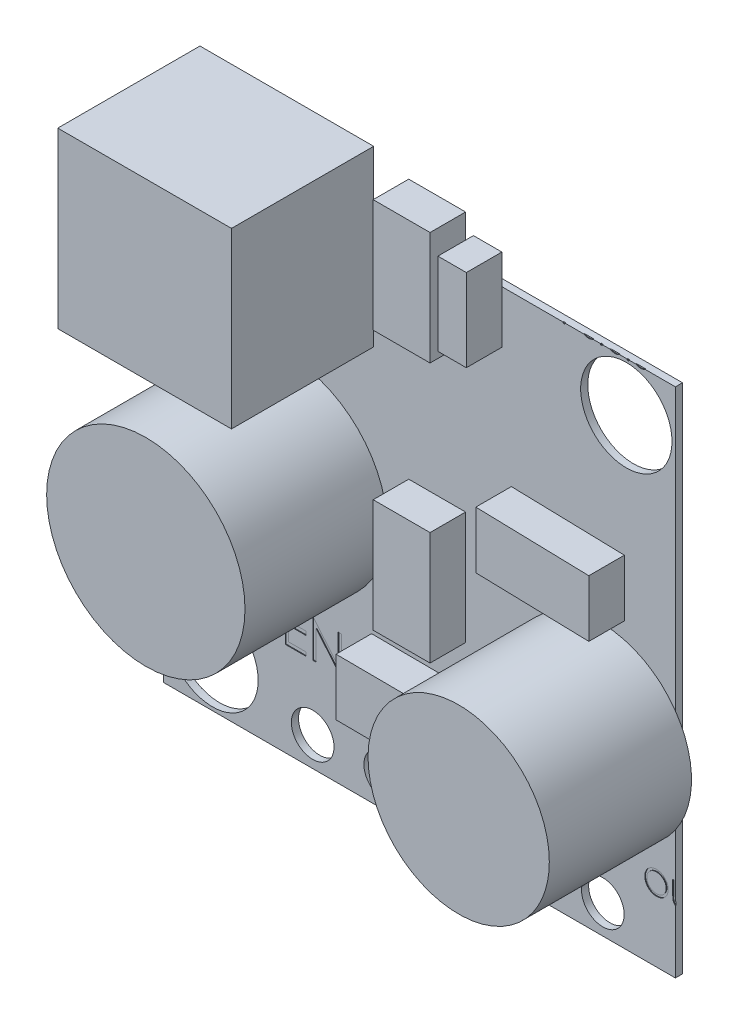
from build123d import *

# Parameters (mm, degrees)
SKETCH1_W           = 18.291840078
SKETCH1_H           = 18.291840078
SKETCH1_R           = 1.63195
SKETCH1_R_2         = 0.762
BOSS_EXTRUDE2_DEPTH = 0.254
SKETCH2_R           = 3.5433
SKETCH2_R_2         = 3.2385
SKETCH2_W           = 6.206288666
SKETCH2_H           = 6.206288667
BOSS_EXTRUDE3_DEPTH = 5.08
SKETCH3_W           = 2.032
SKETCH3_H           = 4.0386
SKETCH3_W_2         = 1.016
SKETCH3_H_2         = 2.9464
BOSS_EXTRUDE4_DEPTH = 1.27
SKETCH4_W           = 0.071233974
SKETCH4_H           = 0.814102564
SKETCH4_W_2         = 0.071233975
SKETCH4_H_2         = 0.79375
CUT_EXTRUDE1_DEPTH  = 0.0254


with BuildPart() as part:
    # Sketch1 → Boss-Extrude2 (new body)
    with BuildSketch(Plane.XY):
        with Locations((8.062281232, 8.564786777)):
            Rectangle(SKETCH1_W, SKETCH1_H)
        with Locations((0.668961193, 1.171466738)):
            Circle(SKETCH1_R, mode=Mode.SUBTRACT)
        with Locations((15.455601271, 15.958106816)):
            Circle(SKETCH1_R, mode=Mode.SUBTRACT)
        with Locations((4.250361193, 0.465539417)):
            Circle(SKETCH1_R_2, mode=Mode.SUBTRACT)
        with Locations((6.841929209, 0.465539417)):
            Circle(SKETCH1_R_2, mode=Mode.SUBTRACT)
        with Locations((9.433497224, 0.465539417)):
            Circle(SKETCH1_R_2, mode=Mode.SUBTRACT)
        with Locations((12.02506524, 0.465539417)):
            Circle(SKETCH1_R_2, mode=Mode.SUBTRACT)
        with Locations((14.616633255, 0.465539417)):
            Circle(SKETCH1_R_2, mode=Mode.SUBTRACT)
    extrude(amount=BOSS_EXTRUDE2_DEPTH)

    # Sketch2 → Boss-Extrude3 (add)
    with BuildSketch(Plane.XY.offset(0.254)):
        with Locations((3.367424674, 8.222212501)):
            Circle(SKETCH2_R)
        with Locations((14.545239743, 5.842060174)):
            Circle(SKETCH2_R_2)
        with Locations((3.324815917, 16.660413121)):
            Rectangle(SKETCH2_W, SKETCH2_H)
    extrude(amount=BOSS_EXTRUDE3_DEPTH)

    # Sketch3 → Boss-Extrude4 (add)
    with BuildSketch(Plane.XY.offset(0.254)):
        Polygon((6.3543759, 4.646336431), (10.392892165, 4.620330016), (10.393031369, 2.588330021), (6.354515103, 2.614336436), align=None)
        with Locations((8.696702908, 8.069982675)):
            Rectangle(SKETCH3_W, SKETCH3_H)
        with Locations((8.696702908, 17.354271733)):
            Rectangle(SKETCH3_W, SKETCH3_H)
        Polygon((11.34760699, 11.694074063), (15.38486701, 11.590047681), (15.387094643, 9.558048902), (11.349834623, 9.662075284), align=None)
        with Locations((10.50132769, 17.309698928)):
            Rectangle(SKETCH3_W_2, SKETCH3_H_2)
    extrude(amount=BOSS_EXTRUDE4_DEPTH)

    # Sketch4 → Cut-Extrude1 (cut)
    # profile 1 of 17: a face of its own
    with BuildSketch(Plane.XY.offset(0.254)):
        with BuildLine():
            Line((13.191799409, 18.469298806), (13.347464724, 18.469298806))
            add(Edge.make_bspline(
                [(13.347464724, 18.469298806), (13.358171483, 18.469287037), (13.378686109, 18.469264486), (13.40810363, 18.468580785), (13.434821194, 18.467667589), (13.458781192, 18.466401695), (13.480057342, 18.464905683), (13.498553373, 18.462807453), (13.514414665, 18.460616635), (13.523918449, 18.458389281), (13.528252735, 18.457373476)],
                knots=[0, 0, 0, 0, 1.415646017, 2.712440637, 3.8905458, 4.950247383, 5.884950622, 6.709939814, 7.411656543, 8, 8, 8, 8], degree=3))
            add(Edge.make_bspline(
                [(13.528252735, 18.457373476), (13.533739482, 18.455871712), (13.54458369, 18.452903572), (13.560209462, 18.446958674), (13.575076138, 18.439909683), (13.589234723, 18.43187604), (13.602511231, 18.422513063), (13.615103744, 18.412200297), (13.626901133, 18.400699637), (13.637837055, 18.388140077), (13.647880215, 18.374732458), (13.656527482, 18.36027663), (13.663768121, 18.345015924), (13.669978256, 18.328960954), (13.674447852, 18.311976898), (13.677814917, 18.294181769), (13.679952061, 18.275577473), (13.680156749, 18.262863896), (13.680260948, 18.256391905)],
                knots=[0, 0, 0, 0, 0.999701418, 1.975846123, 2.934577507, 3.890451536, 4.834027766, 5.787354733, 6.749476667, 7.726910423, 8.712836071, 9.690891519, 10.682875813, 11.679750201, 12.712814741, 13.765529915, 14.8625177, 16, 16, 16, 16], degree=3))
            add(Edge.make_bspline(
                [(13.680260948, 18.256391905), (13.680165375, 18.249865517), (13.679978379, 18.237096196), (13.677734043, 18.218415225), (13.674710946, 18.200563018), (13.670062508, 18.183579161), (13.663974292, 18.167564513), (13.656832345, 18.152274341), (13.648218223, 18.137968772), (13.638320199, 18.124595872), (13.627309391, 18.112143089), (13.615232385, 18.100700662), (13.602137938, 18.090335571), (13.588067666, 18.081024579), (13.572884396, 18.072983601), (13.556818408, 18.065781498), (13.539730055, 18.059732883), (13.527904878, 18.056551065), (13.521892558, 18.054933322)],
                knots=[0, 0, 0, 0, 1.121902311, 2.195077645, 3.232258892, 4.234102512, 5.217864754, 6.176164875, 7.132989551, 8.084763148, 9.034132444, 9.988522005, 10.94243251, 11.903244335, 12.886203696, 13.894208494, 14.929344452, 16, 16, 16, 16], degree=3))
            add(Edge.make_bspline(
                [(13.521892558, 18.054933322), (13.516919752, 18.053875824), (13.506021558, 18.051558257), (13.48807312, 18.048970982), (13.467175863, 18.046762633), (13.44335831, 18.045106839), (13.41664184, 18.043689345), (13.387012002, 18.042562652), (13.35441063, 18.041943561), (13.331670545, 18.041911631), (13.319797957, 18.04189496)],
                knots=[0, 0, 0, 0, 0.601384939, 1.31797006, 2.144135048, 3.087295005, 4.142315834, 5.309527816, 6.595305764, 8, 8, 8, 8], degree=3))
            Line((13.319797957, 18.04189496), (13.263033384, 18.04189496))
            Line((13.263033384, 18.04189496), (13.263033384, 17.675548806))
            Line((13.263033384, 17.675548806), (13.191799409, 17.675548806))
            Line((13.191799409, 17.675548806), (13.191799409, 18.469298806))
        make_face()
        with BuildLine():
            Line((13.263033384, 18.38788855), (13.263033384, 18.123305217))
            Line((13.263033384, 18.123305217), (13.402003235, 18.121556168))
            add(Edge.make_bspline(
                [(13.402003235, 18.121556168), (13.408788647, 18.121552661), (13.421887745, 18.121545891), (13.440809888, 18.122449683), (13.458365209, 18.123493018), (13.474499782, 18.125020629), (13.489220881, 18.127179914), (13.502553053, 18.129359719), (13.514392919, 18.132513257), (13.528249345, 18.136759381), (13.543689676, 18.144001242), (13.560487138, 18.154512735), (13.57472261, 18.167911396), (13.587041224, 18.182976279), (13.596817021, 18.199735546), (13.603973469, 18.217667251), (13.608178339, 18.236587496), (13.608742172, 18.24953427), (13.609026973, 18.256073896)],
                knots=[0, 0, 0, 0, 1.160613943, 2.240541288, 3.23993089, 4.169200891, 5.011653406, 5.7853311, 6.478053781, 7.106038997, 8.262395093, 9.384106736, 10.481365981, 11.59014053, 12.70357646, 13.786202915, 14.881775077, 16, 16, 16, 16], degree=3))
            add(Edge.make_bspline(
                [(13.609026973, 18.256073896), (13.608740623, 18.262455309), (13.608171394, 18.275140768), (13.603940511, 18.29373238), (13.596830935, 18.31147512), (13.5869756, 18.328024374), (13.575014665, 18.343035049), (13.56111285, 18.356074576), (13.545302878, 18.366556998), (13.530596226, 18.37332276), (13.517533099, 18.377453724), (13.506186566, 18.380344072), (13.493375288, 18.382651754), (13.479095095, 18.384520355), (13.46345667, 18.38611998), (13.446325659, 18.387205371), (13.427766958, 18.387840701), (13.414883132, 18.387872214), (13.408204407, 18.38788855)],
                knots=[0, 0, 0, 0, 1.120700087, 2.227813068, 3.331159281, 4.466773991, 5.599788987, 6.693661531, 7.80175334, 8.91857717, 9.525282508, 10.207424825, 10.974604443, 11.810962634, 12.737642355, 13.736264703, 14.826523623, 16, 16, 16, 16], degree=3))
            Line((13.408204407, 18.38788855), (13.263033384, 18.38788855))
        make_face(mode=Mode.SUBTRACT)
    # profile 2 of 17: a face of its own
    with BuildSketch(Plane.XY.offset(0.254)):
        with BuildLine():
            add(Edge.make_bspline(
                [(14.102894662, 18.265773165), (14.113778397, 18.265541415), (14.135118741, 18.265087009), (14.166371601, 18.260230401), (14.196204159, 18.252803767), (14.22473067, 18.242536823), (14.251585794, 18.228775024), (14.277160702, 18.212353631), (14.301385273, 18.192899364), (14.315904782, 18.177850302), (14.32327477, 18.170211517)],
                knots=[0, 0, 0, 0, 1.054011418, 2.066658804, 3.057071809, 4.030435133, 4.997543892, 5.974964718, 6.972108034, 8, 8, 8, 8], degree=3))
            add(Edge.make_bspline(
                [(14.32327477, 18.170211517), (14.329620677, 18.162905845), (14.342189681, 18.148435886), (14.358306371, 18.124973631), (14.372190546, 18.100675787), (14.383317325, 18.075219697), (14.392090536, 18.048827584), (14.398319363, 18.021408735), (14.402024347, 17.993023703), (14.402523948, 17.973746046), (14.402776973, 17.963982801)],
                knots=[0, 0, 0, 0, 1.025258237, 2.030674902, 3.01204498, 3.988269485, 4.97094183, 5.956517959, 6.965070386, 8, 8, 8, 8], degree=3))
            add(Edge.make_bspline(
                [(14.402776973, 17.963982801), (14.40255442, 17.954162966), (14.402114644, 17.934758515), (14.397954574, 17.906179123), (14.391484132, 17.878467083), (14.382224054, 17.851738415), (14.370349983, 17.825911417), (14.355860488, 17.801098894), (14.338653889, 17.777251892), (14.319149411, 17.754572904), (14.297593003, 17.733670923), (14.274207734, 17.715453619), (14.249453158, 17.699845881), (14.223000112, 17.687273694), (14.195090164, 17.677360958), (14.165663115, 17.670398633), (14.134764679, 17.666189108), (14.113667434, 17.665648548), (14.102894662, 17.665372524)],
                knots=[0, 0, 0, 0, 0.998656419, 1.973391657, 2.932242238, 3.890759089, 4.846373663, 5.82037756, 6.809684879, 7.83454468, 8.860553229, 9.859544525, 10.845671541, 11.83227036, 12.833544569, 13.85385346, 14.904124723, 16, 16, 16, 16], degree=3))
            add(Edge.make_bspline(
                [(14.102894662, 17.665372524), (14.092069109, 17.665649474), (14.070866718, 17.666191894), (14.039859218, 17.670382278), (14.01037943, 17.677357749), (13.982432944, 17.68730627), (13.955866166, 17.699846283), (13.930968157, 17.715406434), (13.907563891, 17.733676326), (13.886002923, 17.75457144), (13.866499668, 17.77725227), (13.849292753, 17.801098796), (13.83480334, 17.825911442), (13.822929247, 17.851738408), (13.813669175, 17.878467085), (13.807198731, 17.906179123), (13.803038661, 17.934758515), (13.802598886, 17.954162966), (13.802376332, 17.963982801)],
                knots=[0, 0, 0, 0, 1.099876186, 2.154163076, 3.173186993, 4.173200201, 5.163417411, 6.152872554, 7.150605724, 8.17532212, 9.198891216, 10.186952605, 11.159729845, 12.11414092, 13.071450619, 14.029093627, 15.002601286, 16, 16, 16, 16], degree=3))
            add(Edge.make_bspline(
                [(13.802376332, 17.963982801), (13.802631083, 17.973692982), (13.803135446, 17.992917471), (13.806836704, 18.021249144), (13.813041234, 18.048621587), (13.821824961, 18.074911829), (13.833054299, 18.100256366), (13.846743377, 18.124614247), (13.863024467, 18.147970409), (13.875543481, 18.162421666), (13.881878536, 18.169734503)],
                knots=[0, 0, 0, 0, 1.031353054, 2.041901799, 3.029428768, 4.008703097, 4.981709435, 5.96992636, 6.972712378, 8, 8, 8, 8], degree=3))
            add(Edge.make_bspline(
                [(13.881878536, 18.169734503), (13.889237413, 18.177439534), (13.903709939, 18.192592833), (13.928055097, 18.211990388), (13.953567088, 18.228753497), (13.980718991, 18.242241853), (14.009222068, 18.25286416), (14.039207503, 18.260249554), (14.070566415, 18.265069511), (14.092011186, 18.265536276), (14.102894662, 18.265773165)],
                knots=[0, 0, 0, 0, 1.027980169, 2.021703884, 2.998553061, 3.971491411, 4.943284454, 5.930300938, 6.949603206, 8, 8, 8, 8], degree=3))
        make_face()
        with BuildLine():
            add(Edge.make_bspline(
                [(14.102576653, 18.194539191), (14.094880087, 18.194320435), (14.079685642, 18.193888571), (14.057320129, 18.190603829), (14.035789059, 18.185399662), (14.015051581, 18.178005528), (13.99517763, 18.168458099), (13.976148176, 18.156731382), (13.957907248, 18.142980694), (13.940811673, 18.127227552), (13.925122113, 18.11001928), (13.911406571, 18.091684027), (13.899744092, 18.072519195), (13.890028556, 18.052504854), (13.882792461, 18.031438182), (13.877537151, 18.009557753), (13.874255507, 17.986818989), (13.873827703, 17.971361044), (13.873610307, 17.963505788)],
                knots=[0, 0, 0, 0, 1.021534396, 2.016698045, 2.994645724, 3.958388632, 4.93408049, 5.916473867, 6.921342795, 7.962252576, 8.998418191, 10.008913653, 10.997312074, 11.973003931, 12.956656626, 13.948281152, 14.957379055, 16, 16, 16, 16], degree=3))
            add(Edge.make_bspline(
                [(13.873610307, 17.963505788), (13.873974711, 17.953356667), (13.874697986, 17.933212561), (13.880579728, 17.903546467), (13.890419116, 17.875066297), (13.903705874, 17.847939009), (13.920353356, 17.822840118), (13.939967387, 17.800462835), (13.962337462, 17.78114391), (13.987196918, 17.765114504), (14.014037987, 17.752378273), (14.042444331, 17.743352434), (14.072071774, 17.737485104), (14.092319368, 17.73690193), (14.102576653, 17.736606499)],
                knots=[0, 0, 0, 0, 1.016792936, 2.018143844, 3.017858371, 4.030088057, 5.03801393, 6.028138512, 7.003788237, 7.991172063, 8.984598303, 9.972568034, 10.972917682, 12, 12, 12, 12], degree=3))
            add(Edge.make_bspline(
                [(14.102576653, 17.736606499), (14.112833347, 17.736903651), (14.133079777, 17.737490223), (14.162666055, 17.743322884), (14.190994759, 17.752417821), (14.217807949, 17.76510018), (14.242656089, 17.781204781), (14.265187051, 17.800353745), (14.284633611, 17.822899386), (14.301264624, 17.847972254), (14.314768975, 17.875024241), (14.324562308, 17.903551723), (14.330458189, 17.933211222), (14.331179556, 17.953356219), (14.331542999, 17.963505788)],
                knots=[0, 0, 0, 0, 1.02726834, 2.027799167, 3.010890988, 4.004497153, 4.992059811, 5.971914811, 6.958719428, 7.966827853, 8.981595046, 9.981490638, 10.983022906, 12, 12, 12, 12], degree=3))
            add(Edge.make_bspline(
                [(14.331542999, 17.963505788), (14.331325677, 17.971361091), (14.330898021, 17.986819128), (14.327615305, 18.009557221), (14.32236396, 18.031440136), (14.315113254, 18.052497644), (14.305439933, 18.072571016), (14.293552553, 18.091627757), (14.279893017, 18.110082795), (14.264014134, 18.127171925), (14.246936404, 18.142986835), (14.228688083, 18.156736714), (14.209686846, 18.168406562), (14.189870632, 18.178087191), (14.169130496, 18.185332392), (14.147629594, 18.190633878), (14.125359506, 18.19387469), (14.110219509, 18.194316274), (14.102576653, 18.194539191)],
                knots=[0, 0, 0, 0, 1.042956736, 2.052379634, 3.044323526, 4.02829302, 5.004299113, 5.996692471, 7.007513377, 8.048758398, 9.090003419, 10.095195979, 11.07790575, 12.047570684, 13.018257071, 13.989683339, 14.985167495, 16, 16, 16, 16], degree=3))
        make_face(mode=Mode.SUBTRACT)
    # profile 3 of 17: a face of its own
    with BuildSketch(Plane.XY.offset(0.254)):
        with Locations((14.570685627, 18.082600088)):
            Rectangle(SKETCH4_W, SKETCH4_H)
    # profile 4 of 17: a face of its own
    with BuildSketch(Plane.XY.offset(0.254)):
        with BuildLine():
            add(Edge.make_bspline(
                [(15.049288892, 18.265773165), (15.060172628, 18.265541415), (15.081512972, 18.265087009), (15.112765832, 18.260230401), (15.14259839, 18.252803767), (15.171124901, 18.242536823), (15.197980025, 18.228775024), (15.223554932, 18.212353631), (15.247779504, 18.192899364), (15.262299012, 18.177850302), (15.269669001, 18.170211517)],
                knots=[0, 0, 0, 0, 1.054011418, 2.066658804, 3.057071809, 4.030435133, 4.997543892, 5.974964718, 6.972108034, 8, 8, 8, 8], degree=3))
            add(Edge.make_bspline(
                [(15.269669001, 18.170211517), (15.276014908, 18.162905845), (15.288583912, 18.148435886), (15.304700602, 18.124973631), (15.318584777, 18.100675787), (15.329711556, 18.075219697), (15.338484767, 18.048827584), (15.344713594, 18.021408735), (15.348418578, 17.993023703), (15.348918179, 17.973746046), (15.349171204, 17.963982801)],
                knots=[0, 0, 0, 0, 1.025258237, 2.030674902, 3.01204498, 3.988269485, 4.97094183, 5.956517959, 6.965070386, 8, 8, 8, 8], degree=3))
            add(Edge.make_bspline(
                [(15.349171204, 17.963982801), (15.348948651, 17.954162966), (15.348508875, 17.934758515), (15.344348805, 17.906179123), (15.337878362, 17.878467083), (15.328618285, 17.851738415), (15.316744214, 17.825911417), (15.302254718, 17.801098894), (15.285048119, 17.777251892), (15.265543642, 17.754572904), (15.243987234, 17.733670923), (15.220601965, 17.715453619), (15.195847389, 17.699845881), (15.169394343, 17.687273694), (15.141484395, 17.677360958), (15.112057346, 17.670398633), (15.08115891, 17.666189108), (15.060061665, 17.665648548), (15.049288892, 17.665372524)],
                knots=[0, 0, 0, 0, 0.998656419, 1.973391657, 2.932242238, 3.890759089, 4.846373663, 5.82037756, 6.809684879, 7.83454468, 8.860553229, 9.859544525, 10.845671541, 11.83227036, 12.833544569, 13.85385346, 14.904124723, 16, 16, 16, 16], degree=3))
            add(Edge.make_bspline(
                [(15.049288892, 17.665372524), (15.03846334, 17.665649474), (15.017260949, 17.666191894), (14.986253449, 17.670382278), (14.956773661, 17.677357749), (14.928827175, 17.68730627), (14.902260397, 17.699846283), (14.877362388, 17.715406434), (14.853958121, 17.733676326), (14.832397153, 17.75457144), (14.812893898, 17.77725227), (14.795686984, 17.801098796), (14.781197571, 17.825911442), (14.769323478, 17.851738408), (14.760063406, 17.878467085), (14.753592962, 17.906179123), (14.749432892, 17.934758515), (14.748993116, 17.954162966), (14.748770563, 17.963982801)],
                knots=[0, 0, 0, 0, 1.099876186, 2.154163076, 3.173186993, 4.173200201, 5.163417411, 6.152872554, 7.150605724, 8.17532212, 9.198891216, 10.186952605, 11.159729845, 12.11414092, 13.071450619, 14.029093627, 15.002601286, 16, 16, 16, 16], degree=3))
            add(Edge.make_bspline(
                [(14.748770563, 17.963982801), (14.749025314, 17.973692982), (14.749529677, 17.992917471), (14.753230935, 18.021249144), (14.759435465, 18.048621587), (14.768219192, 18.074911829), (14.77944853, 18.100256366), (14.793137608, 18.124614247), (14.809418698, 18.147970409), (14.821937712, 18.162421666), (14.828272767, 18.169734503)],
                knots=[0, 0, 0, 0, 1.031353054, 2.041901799, 3.029428768, 4.008703097, 4.981709435, 5.96992636, 6.972712378, 8, 8, 8, 8], degree=3))
            add(Edge.make_bspline(
                [(14.828272767, 18.169734503), (14.835631644, 18.177439534), (14.85010417, 18.192592833), (14.874449328, 18.211990388), (14.899961319, 18.228753497), (14.927113222, 18.242241853), (14.955616299, 18.25286416), (14.985601734, 18.260249554), (15.016960646, 18.265069511), (15.038405417, 18.265536276), (15.049288892, 18.265773165)],
                knots=[0, 0, 0, 0, 1.027980169, 2.021703884, 2.998553061, 3.971491411, 4.943284454, 5.930300938, 6.949603206, 8, 8, 8, 8], degree=3))
        make_face()
        with BuildLine():
            add(Edge.make_bspline(
                [(15.048970884, 18.194539191), (15.041274318, 18.194320435), (15.026079873, 18.193888571), (15.00371436, 18.190603829), (14.982183289, 18.185399662), (14.961445812, 18.178005528), (14.941571861, 18.168458099), (14.922542407, 18.156731382), (14.904301479, 18.142980694), (14.887205903, 18.127227552), (14.871516343, 18.11001928), (14.857800802, 18.091684027), (14.846138323, 18.072519195), (14.836422787, 18.052504854), (14.829186692, 18.031438182), (14.823931382, 18.009557753), (14.820649738, 17.986818989), (14.820221934, 17.971361044), (14.820004537, 17.963505788)],
                knots=[0, 0, 0, 0, 1.021534396, 2.016698045, 2.994645724, 3.958388632, 4.93408049, 5.916473867, 6.921342795, 7.962252576, 8.998418191, 10.008913653, 10.997312074, 11.973003931, 12.956656626, 13.948281152, 14.957379055, 16, 16, 16, 16], degree=3))
            add(Edge.make_bspline(
                [(14.820004537, 17.963505788), (14.820368942, 17.953356667), (14.821092217, 17.933212561), (14.826973958, 17.903546467), (14.836813347, 17.875066297), (14.850100105, 17.847939009), (14.866747587, 17.822840118), (14.886361618, 17.800462835), (14.908731693, 17.78114391), (14.933591149, 17.765114504), (14.960432218, 17.752378273), (14.988838562, 17.743352434), (15.018466005, 17.737485104), (15.038713599, 17.73690193), (15.048970884, 17.736606499)],
                knots=[0, 0, 0, 0, 1.016792936, 2.018143844, 3.017858371, 4.030088057, 5.03801393, 6.028138512, 7.003788237, 7.991172063, 8.984598303, 9.972568034, 10.972917682, 12, 12, 12, 12], degree=3))
            add(Edge.make_bspline(
                [(15.048970884, 17.736606499), (15.059227578, 17.736903651), (15.079474008, 17.737490223), (15.109060285, 17.743322884), (15.13738899, 17.752417821), (15.164202179, 17.76510018), (15.18905032, 17.781204781), (15.211581281, 17.800353745), (15.231027841, 17.822899386), (15.247658855, 17.847972254), (15.261163206, 17.875024241), (15.270956539, 17.903551723), (15.27685242, 17.933211222), (15.277573787, 17.953356219), (15.27793723, 17.963505788)],
                knots=[0, 0, 0, 0, 1.02726834, 2.027799167, 3.010890988, 4.004497153, 4.992059811, 5.971914811, 6.958719428, 7.966827853, 8.981595046, 9.981490638, 10.983022906, 12, 12, 12, 12], degree=3))
            add(Edge.make_bspline(
                [(15.27793723, 17.963505788), (15.277719908, 17.971361091), (15.277292251, 17.986819128), (15.274009536, 18.009557221), (15.268758191, 18.031440136), (15.261507485, 18.052497644), (15.251834164, 18.072571016), (15.239946784, 18.091627757), (15.226287248, 18.110082795), (15.210408365, 18.127171925), (15.193330635, 18.142986835), (15.175082313, 18.156736714), (15.156081077, 18.168406562), (15.136264863, 18.178087191), (15.115524727, 18.185332392), (15.094023824, 18.190633878), (15.071753737, 18.19387469), (15.05661374, 18.194316274), (15.048970884, 18.194539191)],
                knots=[0, 0, 0, 0, 1.042956736, 2.052379634, 3.044323526, 4.02829302, 5.004299113, 5.996692471, 7.007513377, 8.048758398, 9.090003419, 10.095195979, 11.07790575, 12.047570684, 13.018257071, 13.989683339, 14.985167495, 16, 16, 16, 16], degree=3))
        make_face(mode=Mode.SUBTRACT)
    # profile 5 of 17: a face of its own
    with BuildSketch(Plane.XY.offset(0.254)):
        with Locations((15.517079858, 18.082600088)):
            Rectangle(SKETCH4_W, SKETCH4_H)
    # profile 6 of 17: a face of its own
    with BuildSketch(Plane.XY.offset(0.254)):
        with BuildLine():
            Line((15.705341076, 18.255596883), (15.77657505, 18.255596883))
            Line((15.77657505, 18.255596883), (15.77657505, 17.986561427))
            add(Edge.make_bspline(
                [(15.77657505, 17.986561427), (15.776607232, 17.978664124), (15.776668795, 17.963556956), (15.777086294, 17.941818369), (15.778068297, 17.921993507), (15.779296075, 17.904070918), (15.780874989, 17.888053635), (15.782753536, 17.873997602), (15.784853214, 17.861743421), (15.786908508, 17.854363053), (15.787864363, 17.850930667)],
                knots=[0, 0, 0, 0, 1.388932606, 2.656963016, 3.823490214, 4.879454478, 5.816252168, 6.653371382, 7.373723809, 8, 8, 8, 8], degree=3))
            add(Edge.make_bspline(
                [(15.787864363, 17.850930667), (15.789397765, 17.846616552), (15.792432688, 17.838078011), (15.797937568, 17.825743361), (15.804747565, 17.814318967), (15.812199705, 17.803364293), (15.820794749, 17.793203843), (15.830423951, 17.783854773), (15.840764979, 17.774963845), (15.856130851, 17.764444437), (15.877144649, 17.75316971), (15.904733756, 17.743441552), (15.93464775, 17.737627714), (15.955322606, 17.736953195), (15.965949299, 17.736606499)],
                knots=[0, 0, 0, 0, 0.725840625, 1.436591201, 2.137033971, 2.831655856, 3.53531722, 4.242432219, 4.957935707, 5.694543706, 7.190802206, 8.724350549, 10.316345118, 12, 12, 12, 12], degree=3))
            add(Edge.make_bspline(
                [(15.965949299, 17.736606499), (15.976575005, 17.736960568), (15.997133781, 17.737645625), (16.026719104, 17.743266178), (16.053763621, 17.752656397), (16.077995891, 17.765766292), (16.099306001, 17.781809581), (16.117064324, 17.800634793), (16.131716327, 17.82164635), (16.13811382, 17.837322749), (16.14133116, 17.845206509)],
                knots=[0, 0, 0, 0, 1.157059328, 2.238695713, 3.266970494, 4.264342957, 5.228770407, 6.160125903, 7.074715775, 8, 8, 8, 8], degree=3))
            add(Edge.make_bspline(
                [(16.14133116, 17.845206509), (16.142282352, 17.848373866), (16.144385204, 17.855376118), (16.146644523, 17.867255097), (16.148679802, 17.881421177), (16.150417701, 17.897967057), (16.151657122, 17.916849497), (16.152325239, 17.938062596), (16.153080044, 17.961539762), (16.1530915, 17.977974414), (16.153097486, 17.986561427)],
                knots=[0, 0, 0, 0, 0.557542046, 1.232589297, 2.036731608, 2.971723315, 4.038036528, 5.22795436, 6.551621927, 8, 8, 8, 8], degree=3))
            Line((16.153097486, 17.986561427), (16.153097486, 18.255596883))
            Line((16.153097486, 18.255596883), (16.224331461, 18.255596883))
            Line((16.224331461, 18.255596883), (16.224331461, 17.973205056))
            add(Edge.make_bspline(
                [(16.224331461, 17.973205056), (16.22423129, 17.963610394), (16.224036947, 17.944995437), (16.22278796, 17.917943505), (16.220644923, 17.892733496), (16.217392207, 17.869352066), (16.213567313, 17.847817065), (16.208633301, 17.828100894), (16.202741808, 17.810264299), (16.196095735, 17.793994289), (16.188243991, 17.779242583), (16.179892148, 17.765241781), (16.170248138, 17.752339276), (16.160094888, 17.739892792), (16.148800584, 17.72852141), (16.136576866, 17.7179642), (16.123595783, 17.70805978), (16.109569269, 17.699194437), (16.09470209, 17.691207804), (16.078975894, 17.684128444), (16.06219806, 17.678526252), (16.044585057, 17.673693298), (16.026050591, 17.669902695), (16.00661253, 17.66722967), (15.986277423, 17.665591068), (15.97241867, 17.665446595), (15.965313281, 17.665372524)],
                knots=[0, 0, 0, 0, 1.493040784, 2.896703357, 4.213163133, 5.428574705, 6.569057535, 7.615249723, 8.588095153, 9.490268104, 10.346124644, 11.18633936, 12.024365274, 12.850166724, 13.684164916, 14.514361689, 15.362232829, 16.222528818, 17.093394965, 17.986930858, 18.902426812, 19.842810585, 20.827885679, 21.843828298, 22.894529745, 24, 24, 24, 24], degree=3))
            add(Edge.make_bspline(
                [(15.965313281, 17.665372524), (15.958261036, 17.665449565), (15.944402718, 17.665600957), (15.924066561, 17.667220617), (15.904574645, 17.669898542), (15.885996269, 17.673721064), (15.868312789, 17.678492425), (15.851452578, 17.684162869), (15.835613055, 17.691211479), (15.820603922, 17.699143889), (15.806542666, 17.708116728), (15.793364471, 17.71795198), (15.781087006, 17.728634962), (15.769707564, 17.740121059), (15.759385871, 17.752552757), (15.749993305, 17.765830054), (15.741385266, 17.779821392), (15.733594544, 17.794803573), (15.726901699, 17.811261868), (15.720992742, 17.829472103), (15.716159794, 17.849633924), (15.712226769, 17.871730093), (15.709062782, 17.895654862), (15.706866103, 17.921546627), (15.70563787, 17.949342322), (15.70544214, 17.968539707), (15.705341076, 17.978452202)],
                knots=[0, 0, 0, 0, 1.083640291, 2.129454052, 3.13281866, 4.105697902, 5.042300162, 5.946461698, 6.836384745, 7.703652036, 8.553297018, 9.397182691, 10.228592656, 11.052265423, 11.879314572, 12.708807002, 13.549817954, 14.402308542, 15.300838682, 16.27712199, 17.341985831, 18.484375296, 19.725102775, 21.0496083, 22.476576903, 24, 24, 24, 24], degree=3))
            Line((15.705341076, 17.978452202), (15.705341076, 18.255596883))
        make_face()
    # profile 7 of 17: a face of its own
    with BuildSketch(Plane.XY.offset(0.254)):
        Polygon((3.27317911, 4.096791439), (4.019439794, 4.096791439), (4.019439794, 3.961107678), (3.3919024, 3.961107678), (3.3919024, 3.554056396), (4.019439794, 3.554056396), (4.019439794, 3.418372636), (3.3919024, 3.418372636), (3.3919024, 2.909558533), (4.019439794, 2.909558533), (4.019439794, 2.773874772), (3.27317911, 2.773874772), align=None)
    # profile 8 of 17: a face of its own
    with BuildSketch(Plane.XY.offset(0.254)):
        Polygon((4.256886375, 2.773874772), (4.256886375, 4.096791439), (4.281797065, 4.096791439), (5.155791289, 3.05557758), (5.155791289, 4.096791439), (5.27451458, 4.096791439), (5.27451458, 2.773874772), (5.247483831, 2.773874772), (4.375609665, 3.812703565), (4.375609665, 2.773874772), align=None)
    # profile 9 of 17: a face of its own
    with BuildSketch(Plane.XY.offset(0.254)):
        Polygon((7.071247738, 2.423342648), (7.147569853, 2.423342648), (7.412153187, 1.79781931), (7.67673652, 2.423342648), (7.753058635, 2.423342648), (7.417241328, 1.629592648), (7.407065046, 1.629592648), align=None)
    # profile 10 of 17: a face of its own
    with BuildSketch(Plane.XY.offset(0.254)):
        with Locations((7.931143572, 2.026467648)):
            Rectangle(SKETCH4_W_2, SKETCH4_H_2)
    # profile 11 of 17: a face of its own
    with BuildSketch(Plane.XY.offset(0.254)):
        Polygon((8.1702862, 1.629592648), (8.1702862, 2.423342648), (8.185232614, 2.423342648), (8.709629148, 1.798614332), (8.709629148, 2.423342648), (8.780863123, 2.423342648), (8.780863123, 1.629592648), (8.764644673, 1.629592648), (8.241520174, 2.252889923), (8.241520174, 1.629592648), align=None)
    # profile 12 of 17: a face of its own
    with BuildSketch(Plane.XY.offset(0.254)):
        with BuildLine():
            Line((11.203994747, 2.287870893), (11.142937054, 2.229993289))
            add(Edge.make_bspline(
                [(11.142937054, 2.229993289), (11.131888307, 2.240387074), (11.110054275, 2.260926798), (11.074457934, 2.287576613), (11.037318681, 2.310406246), (10.998830311, 2.328981411), (10.959945961, 2.343802483), (10.921181756, 2.354354401), (10.88293532, 2.361083708), (10.857497397, 2.361888428), (10.844962796, 2.362284955)],
                knots=[0, 0, 0, 0, 1.08915593, 2.152340314, 3.188132944, 4.216796309, 5.218260357, 6.173443236, 7.099959455, 8, 8, 8, 8], degree=3))
            add(Edge.make_bspline(
                [(10.844962796, 2.362284955), (10.837271426, 2.362191155), (10.821908635, 2.362003799), (10.799089016, 2.359612521), (10.776508725, 2.356173347), (10.754210388, 2.351197243), (10.73215065, 2.344890545), (10.710406233, 2.337001699), (10.688936576, 2.327804349), (10.667943911, 2.317176609), (10.647592047, 2.305501716), (10.628370407, 2.292563922), (10.610156476, 2.278777892), (10.593292594, 2.263798474), (10.577681757, 2.247761353), (10.562952394, 2.230964853), (10.549622543, 2.21295008), (10.537582225, 2.194048483), (10.526841287, 2.17459204), (10.517359681, 2.154768023), (10.509400163, 2.134642184), (10.503102447, 2.11418927), (10.497906638, 2.093567511), (10.494251395, 2.072634119), (10.492190656, 2.05136668), (10.491834199, 2.037125159), (10.491655003, 2.029965745)],
                knots=[0, 0, 0, 0, 1.02818874, 2.053710826, 3.065248034, 4.081641283, 5.106893873, 6.131558223, 7.173050175, 8.228653731, 9.27666206, 10.308777013, 11.325269123, 12.329503258, 13.32196095, 14.316845687, 15.314881793, 16.315733098, 17.311955233, 18.285320748, 19.252783886, 20.203351036, 21.145449891, 22.095197417, 23.042428769, 24, 24, 24, 24], degree=3))
            add(Edge.make_bspline(
                [(10.491655003, 2.029965745), (10.491826389, 2.022647184), (10.492168693, 2.008030048), (10.494359516, 1.986214607), (10.498425385, 1.964723167), (10.503860919, 1.943485108), (10.510660139, 1.922464058), (10.519135726, 1.901751149), (10.529174532, 1.88134715), (10.54079425, 1.861435904), (10.553536478, 1.842040504), (10.56781107, 1.823770756), (10.582974095, 1.806383372), (10.599577962, 1.790264404), (10.617090251, 1.774982699), (10.636034178, 1.760959286), (10.656037236, 1.747924047), (10.677129943, 1.736041264), (10.699083431, 1.725425757), (10.721593444, 1.715986052), (10.744731895, 1.708211988), (10.768377184, 1.701876025), (10.792501122, 1.696682565), (10.817226163, 1.693341449), (10.84237051, 1.690916921), (10.859320164, 1.69073965), (10.86785943, 1.69065034)],
                knots=[0, 0, 0, 0, 0.93586088, 1.869166235, 2.799637598, 3.729985548, 4.670839027, 5.622275134, 6.589130586, 7.576015415, 8.568469353, 9.55398029, 10.53834874, 11.515998671, 12.510579167, 13.508179873, 14.527009472, 15.561807829, 16.601455013, 17.643573243, 18.680854198, 19.719860599, 20.772568776, 21.833555941, 22.908541556, 24, 24, 24, 24], degree=3))
            add(Edge.make_bspline(
                [(10.86785943, 1.69065034), (10.878150591, 1.690865463), (10.898358957, 1.691287894), (10.928064811, 1.694576352), (10.956595151, 1.699712321), (10.983869808, 1.707233873), (11.00992046, 1.716827742), (11.03484261, 1.728392767), (11.058440039, 1.742372532), (11.080783688, 1.758150892), (11.101366121, 1.775730148), (11.119929467, 1.794699516), (11.13617764, 1.814966916), (11.150352813, 1.836412979), (11.162079597, 1.859215218), (11.171705017, 1.883261888), (11.179083103, 1.908563806), (11.18211182, 1.926047087), (11.183642183, 1.934881109)],
                knots=[0, 0, 0, 0, 1.13008108, 2.219097802, 3.278683437, 4.311054135, 5.322181354, 6.324827112, 7.324222904, 8.330512327, 9.32562643, 10.293043162, 11.24128371, 12.174520618, 13.111833804, 14.052305215, 15.015860969, 16, 16, 16, 16], degree=3))
            Line((11.183642183, 1.934881109), (10.919058849, 1.934881109))
            Line((10.919058849, 1.934881109), (10.919058849, 2.016291366))
            Line((10.919058849, 2.016291366), (11.254876157, 2.016291366))
            add(Edge.make_bspline(
                [(11.254876157, 2.016291366), (11.254489295, 2.001117703), (11.253732136, 1.971420104), (11.248421061, 1.928110775), (11.239844816, 1.887205052), (11.228128995, 1.848659855), (11.212962637, 1.812529808), (11.19450851, 1.778778228), (11.172471261, 1.747623159), (11.147635857, 1.71881026), (11.119763903, 1.693108814), (11.089608519, 1.67051961), (11.057119885, 1.651491695), (11.022328732, 1.636011152), (10.985348956, 1.623929371), (10.946094984, 1.615363317), (10.904620049, 1.610231165), (10.876195481, 1.609575441), (10.861658258, 1.609240084)],
                knots=[0, 0, 0, 0, 1.140356446, 2.231883559, 3.274166699, 4.278491846, 5.25512956, 6.21435461, 7.1637429, 8.11826594, 9.068280886, 10.0076534, 10.945064095, 11.891975133, 12.864533718, 13.863980011, 14.907571808, 16, 16, 16, 16], degree=3))
            add(Edge.make_bspline(
                [(10.861658258, 1.609240084), (10.852697924, 1.609369152), (10.835025257, 1.609623717), (10.808924279, 1.611432865), (10.783542961, 1.614217925), (10.758885002, 1.618423694), (10.734859699, 1.623575053), (10.711587044, 1.630171505), (10.688978381, 1.637807085), (10.666998766, 1.646491997), (10.645847699, 1.656554855), (10.625430971, 1.667737576), (10.605635725, 1.679982499), (10.5865968, 1.693501388), (10.568214996, 1.708193124), (10.55060884, 1.724087156), (10.533679768, 1.741134892), (10.523075163, 1.753240489), (10.517731726, 1.759340244)],
                knots=[0, 0, 0, 0, 1.107784379, 2.184907829, 3.233506516, 4.263428166, 5.276301166, 6.270063455, 7.25232949, 8.225834625, 9.190232166, 10.146266622, 11.1027726, 12.066435141, 13.031522626, 14.010570082, 14.99756817, 16, 16, 16, 16], degree=3))
            add(Edge.make_bspline(
                [(10.517731726, 1.759340244), (10.509978845, 1.769017338), (10.494601773, 1.788210898), (10.474808334, 1.818963028), (10.457935158, 1.850804164), (10.444244599, 1.883822946), (10.433554354, 1.917988489), (10.425887579, 1.953257135), (10.421395569, 1.989674301), (10.420748427, 2.014318031), (10.420421029, 2.026785656)],
                knots=[0, 0, 0, 0, 1.023165419, 2.029347347, 3.013907458, 3.994755782, 4.975994455, 5.96558838, 6.970761222, 8, 8, 8, 8], degree=3))
            add(Edge.make_bspline(
                [(10.420421029, 2.026785656), (10.420541733, 2.036121574), (10.420781607, 2.054674757), (10.423690251, 2.082219539), (10.427863429, 2.109275232), (10.433997315, 2.135819718), (10.441729861, 2.161870728), (10.451380383, 2.187440355), (10.462616458, 2.21254369), (10.475676026, 2.237007943), (10.490209466, 2.260508479), (10.505982462, 2.282950695), (10.523218993, 2.303925894), (10.541637576, 2.323699714), (10.561457965, 2.342023738), (10.582494477, 2.359067617), (10.604763324, 2.374854213), (10.628334565, 2.389134872), (10.652856379, 2.401962693), (10.678269987, 2.413208817), (10.70456763, 2.422503248), (10.73155229, 2.430389444), (10.759428223, 2.436221271), (10.78799314, 2.44045054), (10.817395933, 2.443344462), (10.837270532, 2.443577202), (10.847347862, 2.443695212)],
                knots=[0, 0, 0, 0, 1.008945113, 2.00506715, 2.99143336, 3.967273523, 4.948097931, 5.927297278, 6.919902385, 7.919676788, 8.923139349, 9.905703106, 10.883022732, 11.856032218, 12.825136022, 13.798837087, 14.781400844, 15.773989409, 16.776158564, 17.77167057, 18.775803737, 19.789618931, 20.80898985, 21.851988756, 22.910860228, 24, 24, 24, 24], degree=3))
            add(Edge.make_bspline(
                [(10.847347862, 2.443695212), (10.855566178, 2.443563791), (10.871862132, 2.4433032), (10.896111361, 2.441496932), (10.919985777, 2.438634016), (10.94352078, 2.434727227), (10.966636223, 2.429405997), (10.989397958, 2.423038243), (11.01183898, 2.415624205), (11.033888958, 2.406782091), (11.055696154, 2.396746001), (11.077381822, 2.385449029), (11.098871865, 2.372698001), (11.120203552, 2.358455056), (11.141511398, 2.342964817), (11.162458379, 2.325784251), (11.183550119, 2.307590876), (11.197112316, 2.294509381), (11.203994747, 2.287870893)],
                knots=[0, 0, 0, 0, 0.985871117, 1.954866573, 2.915460327, 3.869826059, 4.81536089, 5.759505086, 6.70452669, 7.649098992, 8.607881297, 9.583363685, 10.581137262, 11.603961102, 12.659522466, 13.73993555, 14.853081303, 16, 16, 16, 16], degree=3))
        make_face()
    # profile 13 of 17: a face of its own
    with BuildSketch(Plane.XY.offset(0.254)):
        Polygon((11.41769667, 1.629592648), (11.41769667, 2.423342648), (11.432643084, 2.423342648), (11.957039619, 1.798614332), (11.957039619, 2.423342648), (12.028273593, 2.423342648), (12.028273593, 1.629592648), (12.012055143, 1.629592648), (11.488930644, 2.252889923), (11.488930644, 1.629592648), align=None)
    # profile 14 of 17: a face of its own
    with BuildSketch(Plane.XY.offset(0.254)):
        with BuildLine():
            Line((12.231799234, 1.629592648), (12.231799234, 2.423342648))
            Line((12.231799234, 2.423342648), (12.392075676, 2.423342648))
            add(Edge.make_bspline(
                [(12.392075676, 2.423342648), (12.406015965, 2.423242279), (12.432948529, 2.423048368), (12.471867781, 2.421818873), (12.50787767, 2.419643893), (12.540859765, 2.416475804), (12.570904611, 2.412585741), (12.597928081, 2.407709756), (12.622069906, 2.401952082), (12.63691744, 2.397043203), (12.643938657, 2.394721854)],
                knots=[0, 0, 0, 0, 1.314313732, 2.53924729, 3.670748893, 4.714932338, 5.66265055, 6.526160246, 7.303039223, 8, 8, 8, 8], degree=3))
            add(Edge.make_bspline(
                [(12.643938657, 2.394721854), (12.653122285, 2.391222391), (12.671281288, 2.38430282), (12.697136475, 2.371249873), (12.721476334, 2.356460473), (12.74443139, 2.339915126), (12.765477291, 2.321145354), (12.785436225, 2.300948479), (12.803491707, 2.278590052), (12.820026267, 2.25453376), (12.834934176, 2.229062991), (12.84789252, 2.202226279), (12.858654408, 2.174159912), (12.867588229, 2.144941941), (12.874629122, 2.114508119), (12.879432882, 2.082823011), (12.882601303, 2.050011837), (12.882919721, 2.027747271), (12.883081285, 2.01645037)],
                knots=[0, 0, 0, 0, 0.984719456, 1.947108742, 2.898477687, 3.838006223, 4.779231079, 5.722358779, 6.681677486, 7.655904652, 8.64651281, 9.637519902, 10.640069247, 11.656948941, 12.698408672, 13.768548281, 14.867775369, 16, 16, 16, 16], degree=3))
            add(Edge.make_bspline(
                [(12.883081285, 2.01645037), (12.882938644, 2.006639339), (12.882657556, 1.987305678), (12.880133586, 1.958812118), (12.876465028, 1.931163861), (12.870785361, 1.904492569), (12.863890505, 1.878564562), (12.855053993, 1.853656178), (12.8449313, 1.829538921), (12.833127131, 1.806538887), (12.820168281, 1.784748551), (12.806261386, 1.764207315), (12.791421278, 1.745208291), (12.775506447, 1.727693945), (12.758722554, 1.71169068), (12.740959715, 1.697064812), (12.722172094, 1.684102522), (12.702443841, 1.672294446), (12.681199433, 1.661993758), (12.658036478, 1.653278381), (12.632856193, 1.646056023), (12.605720385, 1.640030124), (12.576582168, 1.635250093), (12.545412974, 1.632046429), (12.512260692, 1.62987996), (12.489496108, 1.629690278), (12.477779052, 1.629592648)],
                knots=[0, 0, 0, 0, 1.105936401, 2.179363191, 3.223086493, 4.248585256, 5.251745608, 6.245858792, 7.225916811, 8.198733463, 9.158002045, 10.082870192, 10.993790845, 11.873723703, 12.748670949, 13.606408763, 14.465103618, 15.319838547, 16.196477973, 17.123216899, 18.106603292, 19.147568657, 20.255746949, 21.433717677, 22.679120308, 24, 24, 24, 24], degree=3))
            Line((12.477779052, 1.629592648), (12.231799234, 1.629592648))
        make_face()
        with BuildLine():
            Line((12.303033208, 1.711002904), (12.394142733, 1.711002904))
            add(Edge.make_bspline(
                [(12.394142733, 1.711002904), (12.407234703, 1.711059169), (12.432415356, 1.711167386), (12.468623509, 1.712116984), (12.501706872, 1.713668638), (12.531670143, 1.715840129), (12.558496404, 1.71871319), (12.582241718, 1.721916516), (12.60282825, 1.725907366), (12.615285462, 1.729524816), (12.621042022, 1.731196464)],
                knots=[0, 0, 0, 0, 1.375205317, 2.645023457, 3.804390687, 4.853969522, 5.800190428, 6.637939096, 7.370582563, 8, 8, 8, 8], degree=3))
            add(Edge.make_bspline(
                [(12.621042022, 1.731196464), (12.628287454, 1.733748156), (12.642605262, 1.738790595), (12.663215794, 1.747988493), (12.682437471, 1.758883748), (12.700605281, 1.770994621), (12.717461504, 1.784748268), (12.733205902, 1.799845617), (12.747806775, 1.816363503), (12.76111327, 1.834281426), (12.773021403, 1.853487862), (12.783333628, 1.87379399), (12.792371386, 1.89497732), (12.799464924, 1.917363147), (12.805024709, 1.940751344), (12.808962772, 1.965143557), (12.811415397, 1.99053523), (12.811701475, 2.007805444), (12.811847311, 2.016609374)],
                knots=[0, 0, 0, 0, 0.998632004, 1.973411704, 2.929992603, 3.868527914, 4.809262121, 5.754881198, 6.702106254, 7.672490631, 8.653608572, 9.636854334, 10.631411391, 11.644891563, 12.686317036, 13.754757253, 14.855430412, 16, 16, 16, 16], degree=3))
            add(Edge.make_bspline(
                [(12.811847311, 2.016609374), (12.811730905, 2.025892503), (12.811502223, 2.044129291), (12.808627871, 2.070887895), (12.804427447, 2.096623686), (12.798353289, 2.121338384), (12.790612894, 2.145080206), (12.780953037, 2.167717845), (12.769916143, 2.189490378), (12.756784494, 2.209895279), (12.742402743, 2.22919318), (12.726442045, 2.246872242), (12.709155976, 2.262972735), (12.690733073, 2.2777454), (12.670654123, 2.290595912), (12.649392126, 2.302090928), (12.626635161, 2.311846317), (12.610802639, 2.317034916), (12.602756516, 2.319671774)],
                knots=[0, 0, 0, 0, 1.122418816, 2.205001699, 3.251619955, 4.274784885, 5.280384055, 6.268708349, 7.249350384, 8.229342522, 9.199999885, 10.157847722, 11.105861043, 12.055065948, 13.010012805, 13.98527497, 14.976112212, 16, 16, 16, 16], degree=3))
            add(Edge.make_bspline(
                [(12.602756516, 2.319671774), (12.596100095, 2.321512464), (12.581946718, 2.325426276), (12.558850983, 2.329695601), (12.532857904, 2.333461265), (12.503852079, 2.336649427), (12.471866571, 2.338937087), (12.436876781, 2.340654153), (12.398867585, 2.341812265), (12.372519046, 2.341891347), (12.358843755, 2.341932391)],
                knots=[0, 0, 0, 0, 0.674548936, 1.434276114, 2.292660221, 3.240891867, 4.284742987, 5.42552168, 6.663806718, 8, 8, 8, 8], degree=3))
            Line((12.358843755, 2.341932391), (12.303033208, 2.341932391))
            Line((12.303033208, 2.341932391), (12.303033208, 1.711002904))
        make_face(mode=Mode.SUBTRACT)
    # profile 15 of 17: a face of its own
    with BuildSketch(Plane.XY.offset(0.254)):
        with BuildLine():
            add(Edge.make_bspline(
                [(16.527964664, 2.443695212), (16.542662216, 2.443322948), (16.571529422, 2.44259179), (16.613955337, 2.436994922), (16.654458153, 2.427312218), (16.693367809, 2.414416506), (16.730218895, 2.397213815), (16.765288787, 2.376420933), (16.798494042, 2.351820022), (16.829387105, 2.32360125), (16.857657521, 2.292898217), (16.882564463, 2.260132691), (16.90343834, 2.225502784), (16.920580117, 2.18911256), (16.934028195, 2.151044317), (16.943308049, 2.111095106), (16.949235808, 2.069523767), (16.949928815, 2.041169461), (16.950280369, 2.026785656)],
                knots=[0, 0, 0, 0, 1.065120563, 2.091984664, 3.0946048, 4.079830382, 5.057816894, 6.036188127, 7.030412546, 8.04752943, 9.064399622, 10.05169764, 11.02544977, 11.989514704, 12.962713494, 13.945757189, 14.957906945, 16, 16, 16, 16], degree=3))
            add(Edge.make_bspline(
                [(16.950280369, 2.026785656), (16.949928866, 2.012507807), (16.949236014, 1.984364512), (16.943301309, 1.943056981), (16.933993797, 1.903348912), (16.920705001, 1.865306594), (16.903644937, 1.828889897), (16.882632068, 1.794194641), (16.8578804, 1.761209453), (16.829712061, 1.730295688), (16.799005039, 1.701948047), (16.766068889, 1.677246802), (16.731644332, 1.65599151), (16.695288381, 1.639031641), (16.657483194, 1.625476223), (16.617890417, 1.616234109), (16.576695573, 1.610272583), (16.548603399, 1.609588027), (16.53432484, 1.609240084)],
                knots=[0, 0, 0, 0, 1.043624062, 2.057103931, 3.04512605, 4.022047818, 4.998200453, 5.980619268, 6.982898556, 8.009068085, 9.034988726, 10.034168286, 11.015286542, 11.987931943, 12.962482838, 13.94673481, 14.956375938, 16, 16, 16, 16], degree=3))
            add(Edge.make_bspline(
                [(16.53432484, 1.609240084), (16.519941111, 1.609591462), (16.491586951, 1.610284123), (16.449963373, 1.616221692), (16.409986099, 1.625506595), (16.371769452, 1.638775699), (16.335292119, 1.655924607), (16.300482761, 1.676835243), (16.267481098, 1.70164722), (16.236560737, 1.729806425), (16.208269401, 1.760461402), (16.183604329, 1.793307742), (16.16268899, 1.827701033), (16.145597663, 1.863736721), (16.132066616, 1.901240602), (16.122835345, 1.940462846), (16.116862727, 1.981179841), (16.116174467, 2.008902784), (16.115825241, 2.022969551)],
                knots=[0, 0, 0, 0, 1.053102029, 2.075944431, 3.073151272, 4.055350789, 5.033113405, 6.020478099, 7.024410459, 8.052272461, 9.079885166, 10.07527673, 11.055994387, 12.023226415, 12.992069828, 13.970394897, 14.97016774, 16, 16, 16, 16], degree=3))
            add(Edge.make_bspline(
                [(16.115825241, 2.022969551), (16.115946488, 2.032411245), (16.116187454, 2.051175523), (16.119088427, 2.079039913), (16.123297956, 2.106456187), (16.12933089, 2.133346384), (16.137221143, 2.159644679), (16.146531156, 2.185532441), (16.157902157, 2.210747322), (16.170756518, 2.235408769), (16.185103392, 2.259132348), (16.200950214, 2.281556825), (16.217740378, 2.302870372), (16.236147076, 2.322520675), (16.255563663, 2.341079379), (16.276305116, 2.358261281), (16.298244875, 2.374221315), (16.321477344, 2.388604142), (16.34543006, 2.401612374), (16.370121757, 2.412775187), (16.395217087, 2.42235599), (16.420833588, 2.43012132), (16.446903234, 2.4362518), (16.473482925, 2.440426325), (16.500551484, 2.443334697), (16.518787622, 2.443574523), (16.527964664, 2.443695212)],
                knots=[0, 0, 0, 0, 1.037015668, 2.060948919, 3.074880161, 4.083647147, 5.086022904, 6.090072063, 7.104153813, 8.122640571, 9.144368836, 10.147691507, 11.138137339, 12.123020368, 13.103399296, 14.087645067, 15.080126199, 16.082011238, 17.087798457, 18.072939717, 19.057185487, 20.037253025, 21.01195951, 21.997135196, 22.992090687, 24, 24, 24, 24], degree=3))
        make_face()
        with BuildLine():
            add(Edge.make_bspline(
                [(16.531462761, 2.362284955), (16.523930156, 2.362193132), (16.50893696, 2.362010363), (16.486647431, 2.359602871), (16.464651046, 2.356171628), (16.442943262, 2.351277247), (16.421614907, 2.344608828), (16.400467175, 2.336934194), (16.379692911, 2.327585839), (16.359360697, 2.317023815), (16.3396496, 2.305333256), (16.321050291, 2.292412873), (16.30351462, 2.278565666), (16.287085522, 2.263759317), (16.271811238, 2.247918425), (16.257391136, 2.23128314), (16.244403213, 2.213377979), (16.232500234, 2.194688476), (16.221848599, 2.175238975), (16.212376813, 2.155234238), (16.204628904, 2.134511084), (16.198310115, 2.113294338), (16.193071408, 2.091617601), (16.189752643, 2.069316436), (16.187318697, 2.046502901), (16.187146375, 2.031085588), (16.187059215, 2.023287559)],
                knots=[0, 0, 0, 0, 1.008559885, 2.007477868, 2.99961109, 3.989939068, 4.984837346, 5.991145699, 7.001802488, 8.033829008, 9.059044045, 10.069351652, 11.065060232, 12.050310815, 13.029377138, 14.011219647, 14.996725999, 15.989392538, 16.977580475, 17.965360261, 18.951710183, 19.937753436, 20.929683414, 21.935841486, 22.955955122, 24, 24, 24, 24], degree=3))
            add(Edge.make_bspline(
                [(16.187059215, 2.023287559), (16.187348336, 2.01182077), (16.187917125, 1.989262048), (16.192896788, 1.956203915), (16.200567129, 1.924433893), (16.211874067, 1.894125818), (16.226014296, 1.865019168), (16.243482894, 1.837372151), (16.264179151, 1.811177296), (16.287688558, 1.786617476), (16.313388529, 1.764200659), (16.340678273, 1.744523958), (16.369265431, 1.727875562), (16.39922455, 1.714312626), (16.430395688, 1.70356531), (16.462979704, 1.696199621), (16.496759541, 1.691351973), (16.519785243, 1.690886437), (16.531462761, 1.69065034)],
                knots=[0, 0, 0, 0, 1.032063989, 2.030389145, 3.003944642, 3.970395727, 4.937377036, 5.913328081, 6.909231446, 7.93887556, 8.970685674, 9.976071282, 10.964166581, 11.944589148, 12.933237628, 13.927779006, 14.949070134, 16, 16, 16, 16], degree=3))
            add(Edge.make_bspline(
                [(16.531462761, 1.69065034), (16.539311701, 1.690758178), (16.554878508, 1.690972052), (16.578032314, 1.693126216), (16.60076899, 1.696580586), (16.623056647, 1.701554146), (16.644869988, 1.70777878), (16.666300059, 1.715173747), (16.6871186, 1.724399663), (16.707588242, 1.734593216), (16.727181675, 1.746213752), (16.745885948, 1.758695618), (16.763229607, 1.77252243), (16.779646415, 1.787108791), (16.794983408, 1.802748807), (16.809136874, 1.819422143), (16.822059154, 1.837234042), (16.833957614, 1.855895196), (16.844571925, 1.875397918), (16.853820042, 1.895475184), (16.861665947, 1.916077557), (16.867999733, 1.937234753), (16.872963043, 1.958906588), (16.876382953, 1.981122081), (16.878775189, 2.003836789), (16.878955501, 2.019200128), (16.879046395, 2.026944661)],
                knots=[0, 0, 0, 0, 1.047197238, 2.076906641, 3.100256066, 4.114471768, 5.12198147, 6.126382909, 7.136867548, 8.15857795, 9.17633901, 10.174870724, 11.156907918, 12.133735059, 13.104061851, 14.077631395, 15.04955518, 16.038496417, 17.029181396, 18.010275684, 18.986308667, 19.968651475, 20.955262928, 21.950658345, 22.966943676, 24, 24, 24, 24], degree=3))
            add(Edge.make_bspline(
                [(16.879046395, 2.026944661), (16.878955428, 2.034636213), (16.878774979, 2.049893823), (16.876384096, 2.072450115), (16.87295943, 2.094505754), (16.868023959, 2.115974153), (16.861662584, 2.136860782), (16.853818672, 2.157146027), (16.844569149, 2.176905457), (16.833953712, 2.196090235), (16.822021195, 2.214499506), (16.808982322, 2.232098624), (16.794611966, 2.248557085), (16.779320707, 2.264281204), (16.762726595, 2.278935618), (16.7449048, 2.292525189), (16.72607168, 2.305377878), (16.70613104, 2.316972426), (16.685551607, 2.327679939), (16.664434692, 2.336853649), (16.643019521, 2.344648754), (16.621360553, 2.351297423), (16.599275484, 2.356152459), (16.576913544, 2.359605963), (16.554305672, 2.362009525), (16.539101227, 2.362192854), (16.531462761, 2.362284955)],
                knots=[0, 0, 0, 0, 1.02996197, 2.043119294, 3.035359645, 4.018872909, 4.991431989, 5.957985074, 6.929999688, 7.912076566, 8.892894881, 9.867085534, 10.843653904, 11.817741046, 12.803660682, 13.806313499, 14.818574707, 15.856120519, 16.894564902, 17.924820532, 18.937903209, 19.946497019, 20.957711757, 21.963978472, 22.977135795, 24, 24, 24, 24], degree=3))
        make_face(mode=Mode.SUBTRACT)
    # profile 16 of 17: a face of its own
    with BuildSketch(Plane.XY.offset(0.254)):
        with BuildLine():
            Line((17.113100882, 2.423342648), (17.184334856, 2.423342648))
            Line((17.184334856, 2.423342648), (17.184334856, 1.947760466))
            add(Edge.make_bspline(
                [(17.184334856, 1.947760466), (17.184324255, 1.941029299), (17.184304138, 1.92825575), (17.184438512, 1.910074725), (17.184814833, 1.893911149), (17.185052087, 1.879702719), (17.185579893, 1.867514631), (17.186010343, 1.857280856), (17.186563826, 1.849049849), (17.187229015, 1.844246317), (17.187514944, 1.84218154)],
                knots=[0, 0, 0, 0, 1.528628734, 2.90083645, 4.128790002, 5.200304208, 6.127813768, 6.898992206, 7.526736466, 8, 8, 8, 8], degree=3))
            add(Edge.make_bspline(
                [(17.187514944, 1.84218154), (17.188689118, 1.834732363), (17.190971305, 1.820253744), (17.196787537, 1.799637045), (17.204910434, 1.78105616), (17.21453591, 1.763931278), (17.227220627, 1.748739048), (17.242416072, 1.734743727), (17.26082603, 1.722503693), (17.281295846, 1.711311634), (17.303358748, 1.70231616), (17.325903803, 1.695514093), (17.348592122, 1.6913687), (17.363781359, 1.690888699), (17.371324039, 1.69065034)],
                knots=[0, 0, 0, 0, 1.035780045, 2.013197591, 2.933192213, 3.817615948, 4.702609284, 5.640816605, 6.646850145, 7.73207398, 8.84249596, 9.914020372, 10.964143139, 12, 12, 12, 12], degree=3))
            add(Edge.make_bspline(
                [(17.371324039, 1.69065034), (17.377799619, 1.690893874), (17.390713379, 1.691379535), (17.409900909, 1.694387038), (17.428588076, 1.699807345), (17.446867159, 1.706801362), (17.464001043, 1.716042333), (17.479999288, 1.726717327), (17.494278608, 1.739238365), (17.507309262, 1.75309505), (17.51865647, 1.768729612), (17.528492426, 1.785801618), (17.536549199, 1.804567988), (17.54052782, 1.81775658), (17.542571785, 1.824532051)],
                knots=[0, 0, 0, 0, 0.994687771, 1.983630487, 2.973142513, 3.978332533, 4.983357753, 5.956394766, 6.925816176, 7.893390482, 8.871859704, 9.88551698, 10.913711441, 12, 12, 12, 12], degree=3))
            add(Edge.make_bspline(
                [(17.542571785, 1.824532051), (17.543252171, 1.827332531), (17.544768344, 1.83357313), (17.546185084, 1.844123494), (17.547660672, 1.856571617), (17.548684511, 1.871006939), (17.549682645, 1.887381088), (17.550279789, 1.905779364), (17.550555794, 1.926134961), (17.550638045, 1.940340174), (17.55068101, 1.947760466)],
                knots=[0, 0, 0, 0, 0.558680831, 1.244966039, 2.062412453, 2.990489873, 4.051219941, 5.244515665, 6.560634259, 8, 8, 8, 8], degree=3))
            Line((17.55068101, 1.947760466), (17.55068101, 2.423342648))
            Line((17.55068101, 2.423342648), (17.621914984, 2.423342648))
            Line((17.621914984, 2.423342648), (17.621914984, 1.94394436))
            add(Edge.make_bspline(
                [(17.621914984, 1.94394436), (17.621857353, 1.935304192), (17.621744883, 1.918442379), (17.620769574, 1.893733767), (17.619214504, 1.870294787), (17.617017384, 1.848122289), (17.614106135, 1.827295614), (17.610868719, 1.807632211), (17.606745861, 1.789273229), (17.601930429, 1.77207552), (17.596425535, 1.755704876), (17.589295132, 1.740168101), (17.581261361, 1.724992871), (17.571733038, 1.710408711), (17.561026171, 1.696351046), (17.548904093, 1.682905131), (17.535767721, 1.669856097), (17.521398678, 1.65753867), (17.506033827, 1.646242774), (17.489718872, 1.636310065), (17.472579141, 1.627913637), (17.454659185, 1.621002133), (17.435951359, 1.615805429), (17.41645519, 1.611933028), (17.396126301, 1.609732685), (17.382300388, 1.609405676), (17.375299149, 1.609240084)],
                knots=[0, 0, 0, 0, 1.316592851, 2.569410997, 3.76748051, 4.895814652, 5.963796859, 6.97159953, 7.931736103, 8.829262218, 9.692595152, 10.560224239, 11.431080259, 12.30701507, 13.211635791, 14.121146779, 15.063487852, 16.031507147, 17.00238618, 17.966455255, 18.938106653, 19.907068911, 20.888905087, 21.893141452, 22.933117798, 24, 24, 24, 24], degree=3))
            add(Edge.make_bspline(
                [(17.375299149, 1.609240084), (17.367663477, 1.609418057), (17.352682317, 1.609767241), (17.330607434, 1.611768114), (17.309445108, 1.615536929), (17.288971828, 1.620335702), (17.26946633, 1.626954156), (17.250667281, 1.634687124), (17.232896651, 1.644184288), (17.215866149, 1.654751004), (17.200030892, 1.666640163), (17.185494516, 1.679598738), (17.172233024, 1.693419145), (17.160469945, 1.708251014), (17.150010387, 1.72397899), (17.141000142, 1.740647568), (17.133263746, 1.758250293), (17.129270828, 1.770486108), (17.127252274, 1.776671724)],
                knots=[0, 0, 0, 0, 1.13879206, 2.234305948, 3.301075583, 4.341971843, 5.366689343, 6.369221514, 7.369726634, 8.367512178, 9.355451585, 10.318319045, 11.268648973, 12.207971039, 13.137398894, 14.081662264, 15.030215811, 16, 16, 16, 16], degree=3))
            add(Edge.make_bspline(
                [(17.127252274, 1.776671724), (17.126078168, 1.780897326), (17.123531507, 1.79006275), (17.120804342, 1.80523165), (17.118511746, 1.822697533), (17.116356022, 1.842461595), (17.11508399, 1.864539154), (17.113968785, 1.88892064), (17.113093025, 1.915635535), (17.11309819, 1.934244327), (17.113100882, 1.94394436)],
                knots=[0, 0, 0, 0, 0.625038921, 1.35572334, 2.194682327, 3.136881307, 4.189498639, 5.346923369, 6.617055217, 8, 8, 8, 8], degree=3))
            Line((17.113100882, 1.94394436), (17.113100882, 2.423342648))
        make_face()
    # profile 17 of 17: a face of its own
    with BuildSketch(Plane.XY.offset(0.254)):
        Polygon((17.733854087, 2.341932391), (17.733854087, 2.423342648), (18.151081651, 2.423342648), (18.151081651, 2.341932391), (17.978084856, 2.341932391), (17.978084856, 1.629592648), (17.906850882, 1.629592648), (17.906850882, 2.341932391), align=None)
    extrude(amount=-CUT_EXTRUDE1_DEPTH, mode=Mode.SUBTRACT)


solid = part.part
